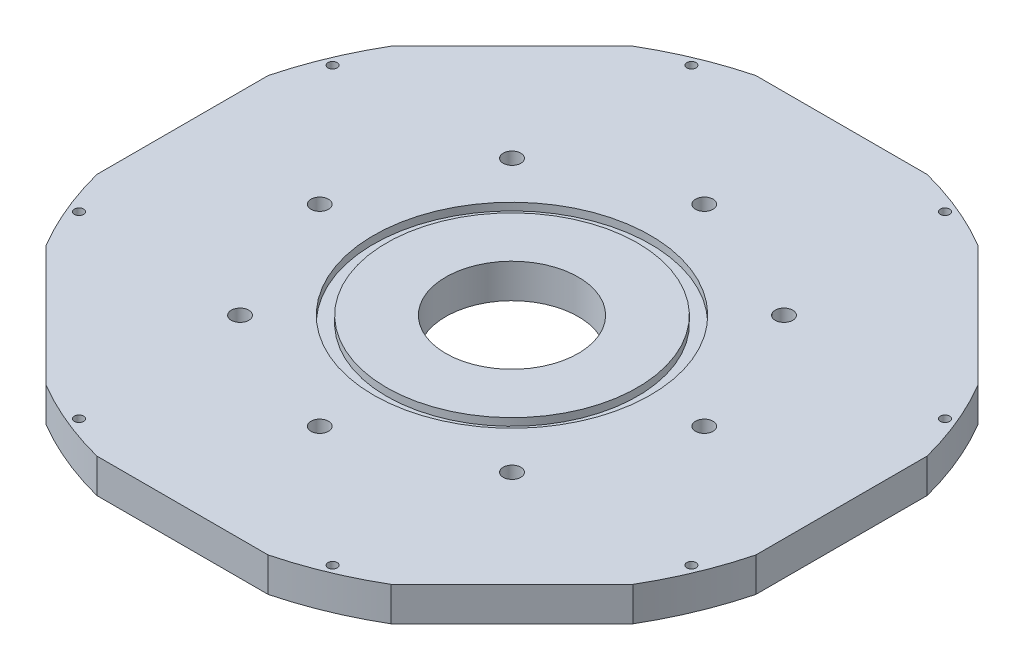
from build123d import *

# Parameters (mm, degrees)
BOSS_EXTRUDE1_DEPTH   = 12.7
SKETCH3_R             = 24.5745
CUT_EXTRUDE1_DEPTH    = 174.423960282
SKETCH5_R             = 51.3715
SKETCH5_R_2           = 46.5455
CUT_EXTRUDE2_DEPTH    = 2.794
SKETCH37_R            = 119.0625
SKETCH37_R_2          = 115.2525
CUT_EXTRUDE7_DEPTH    = 2.667
CIRPATTERN4_COUNT     = 8
F_8_32_TAPPED_HOLE1_D = 3.4544
CIRPATTERN5_COUNT     = 8


with BuildPart() as part:
    # Sketch1 → Boss-Extrude1 (new body)
    with BuildSketch(Plane(origin=(0, 0, 0), x_dir=(1, 0, 0), z_dir=(0, 1, 0))):
        with BuildLine():
            ThreePointArc((-31.793446259, 122.3), (-48.357791931, 116.746037126), (-63.997797892, 108.960520786))
            Line((-63.997797892, 108.960520786), (-108.960520786, 63.997797892))
            ThreePointArc((-108.960520786, 63.997797892), (-116.746037126, 48.357791931), (-122.3, 31.793446259))
            Line((-122.3, 31.793446259), (-122.3, -31.793446259))
            ThreePointArc((-122.3, -31.793446259), (-116.746037126, -48.357791931), (-108.960520786, -63.997797892))
            Line((-108.960520786, -63.997797892), (-63.997797892, -108.960520786))
            ThreePointArc((-63.997797892, -108.960520786), (-48.357791931, -116.746037126), (-31.793446259, -122.3))
            Line((-31.793446259, -122.3), (31.793446259, -122.3))
            ThreePointArc((31.793446259, -122.3), (48.357791931, -116.746037126), (63.997797892, -108.960520786))
            Line((63.997797892, -108.960520786), (108.960520786, -63.997797892))
            ThreePointArc((108.960520786, -63.997797892), (116.746037126, -48.357791931), (122.3, -31.793446259))
            Line((122.3, -31.793446259), (122.3, 31.793446259))
            ThreePointArc((122.3, 31.793446259), (116.746037126, 48.357791931), (108.960520786, 63.997797892))
            Line((108.960520786, 63.997797892), (63.997797892, 108.960520786))
            ThreePointArc((63.997797892, 108.960520786), (48.357791931, 116.746037126), (31.793446259, 122.3))
            Line((31.793446259, 122.3), (-31.793446259, 122.3))
        make_face()
    extrude(amount=BOSS_EXTRUDE1_DEPTH)

    # Sketch3 → Cut-Extrude1 (cut, through all)
    with BuildSketch(Plane(origin=(0, 12.7, 0), x_dir=(1, 0, 0), z_dir=(0, 1, 0))):
        Circle(SKETCH3_R)
    extrude(amount=-CUT_EXTRUDE1_DEPTH, mode=Mode.SUBTRACT)

    # Sketch5 → Cut-Extrude2 (cut)
    with BuildSketch(Plane(origin=(0, 12.7, 0), x_dir=(1, 0, 0), z_dir=(0, 1, 0))):
        Circle(SKETCH5_R)
        Circle(SKETCH5_R_2, mode=Mode.SUBTRACT)
    extrude(amount=-CUT_EXTRUDE2_DEPTH, mode=Mode.SUBTRACT)

    # Sketch23 → 5/16-18 Tapped Hole1 (revolve, cut)
    with BuildSketch(Plane(origin=(-71.374, 12.7, 0), x_dir=(0, 0, 1), z_dir=(1, 0, 0))):
        Polygon((0, 0), (0, 8.311148974), (3.2639, 6.35), (3.2639, 0), align=None)
    f_5_16_18_tapped_hole1 = revolve(axis=Axis((-71.374, 19.05, 0), (0, -1, 0)), mode=Mode.SUBTRACT)

    # Sketch37 → Cut-Extrude7 (cut)
    with BuildSketch(Plane.XZ):
        Circle(SKETCH37_R)
        Circle(SKETCH37_R_2, mode=Mode.SUBTRACT)
    extrude(amount=-CUT_EXTRUDE7_DEPTH, mode=Mode.SUBTRACT)

    # CirPattern4: 5/16-18 Tapped Hole1 ×8 about axis
    cirpattern4_axis = Axis((0, 0, 0), (0, 1, 0))
    for i in range(1, CIRPATTERN4_COUNT):
        add(f_5_16_18_tapped_hole1.rotate(cirpattern4_axis, i * 360 / CIRPATTERN4_COUNT), mode=Mode.SUBTRACT)

    # #8-32 Tapped Hole1 (through all)
    with Locations(Plane(origin=(0, 12.7, 0), x_dir=(1, 0, 0), z_dir=(0, 1, 0))):
        with Locations((-47.069870839, 113.636720559)):
            f_8_32_tapped_hole1 = Hole(F_8_32_TAPPED_HOLE1_D / 2)

    # CirPattern5: #8-32 Tapped Hole1 ×8 about axis
    cirpattern5_axis = Axis((0, 0, 0), (0, 1, 0))
    for i in range(1, CIRPATTERN5_COUNT):
        add(f_8_32_tapped_hole1.rotate(cirpattern5_axis, i * 360 / CIRPATTERN5_COUNT), mode=Mode.SUBTRACT)


solid = part.part
